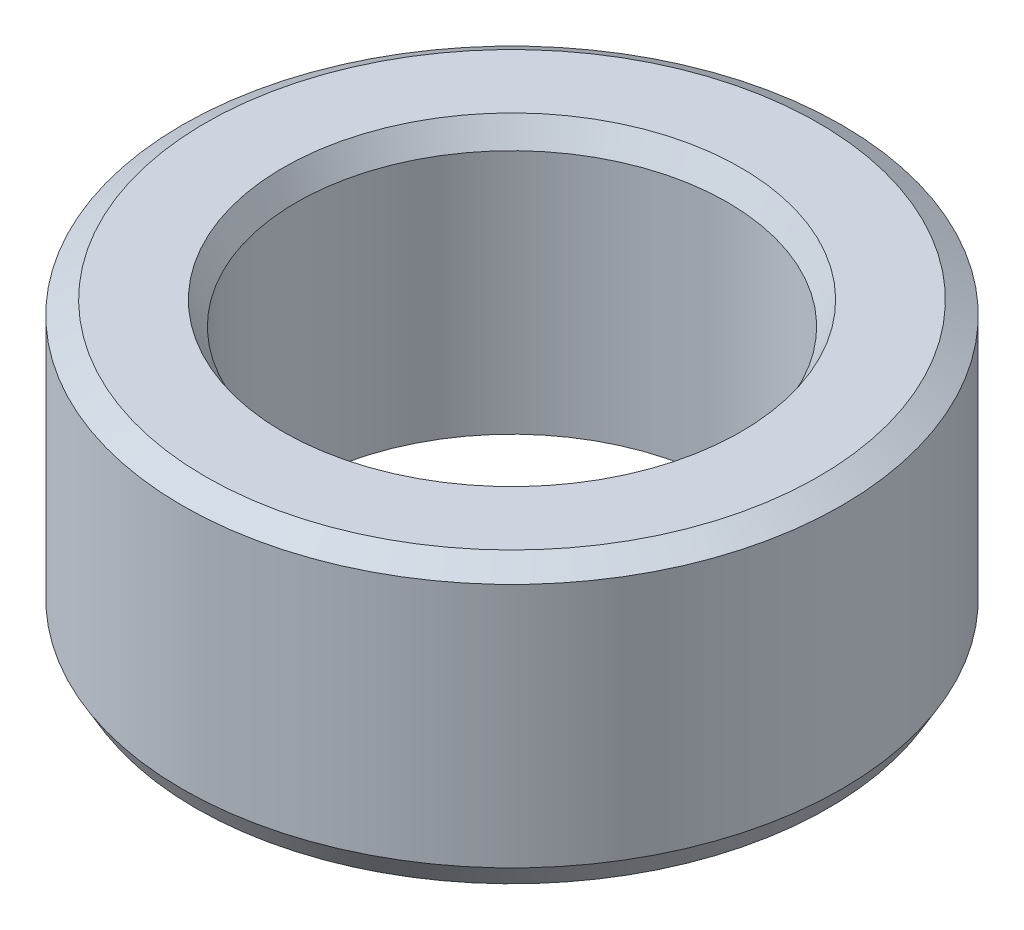
from build123d import *
from OCP.BRepFilletAPI import BRepFilletAPI_MakeChamfer

# Parameters (mm, degrees)
SKETCH1_R           = 50
BOSS_EXTRUDE1_DEPTH = 42.788463699
SKETCH2_R           = 32.672837418
CUT_EXTRUDE1_DEPTH  = 83.648972321
CHAMFER1_SIZE       = 2.033833816
CHAMFER1_SIZE2      = 3.522703503


with BuildPart() as part:
    # Sketch1 → Boss-Extrude1 (new body)
    with BuildSketch(Plane(origin=(0, 0, 0), x_dir=(1, 0, 0), z_dir=(0, 1, 0))):
        Circle(SKETCH1_R)
    extrude(amount=BOSS_EXTRUDE1_DEPTH)

    # Sketch2 → Cut-Extrude1 (cut, through all)
    with BuildSketch(Plane(origin=(0, 0, 0), x_dir=(1, 0, 0), z_dir=(0, 1, 0))):
        Circle(SKETCH2_R)
    extrude(amount=CUT_EXTRUDE1_DEPTH, mode=Mode.SUBTRACT)

    # Chamfer1: one chamfer whose edges measure the first distance from different faces: ONE call of the kernel's chamfer builder (chamfer() names one face for all edges)
    chamfer1_edges_1 = [part.edges().sort_by_distance(p)[0] for p in [
        (-32.672837418, 42.788463699, 0),
    ]]
    chamfer1_side_1 = [part.faces().sort_by_distance(p)[0] for p in [
        (-48.585786438, 42.788463699, 0),
    ]]
    chamfer1_edges_2 = [part.edges().sort_by_distance(p)[0] for p in [
        (-32.672837418, 0, 0),
    ]]
    chamfer1_side_2 = [part.faces().sort_by_distance(p)[0] for p in [
        (-32.672837418, 21.394231849, 0),
    ]]
    chamfer1_edges_3 = [part.edges().sort_by_distance(p)[0] for p in [
        (-50, 0, 0),
    ]]
    chamfer1_side_3 = [part.faces().sort_by_distance(p)[0] for p in [
        (-48.585786438, 0, 0),
    ]]
    chamfer1_edges_4 = [part.edges().sort_by_distance(p)[0] for p in [
        (-50, 42.788463699, 0),
    ]]
    chamfer1_side_4 = [part.faces().sort_by_distance(p)[0] for p in [
        (-50, 21.394231849, 0),
    ]]
    chamfer1 = BRepFilletAPI_MakeChamfer(part.part.solid().wrapped)
    for e in chamfer1_edges_1:
        chamfer1.Add(CHAMFER1_SIZE, CHAMFER1_SIZE2, e.wrapped, chamfer1_side_1[0].wrapped)  # the first distance lies on this face
    for e in chamfer1_edges_2:
        chamfer1.Add(CHAMFER1_SIZE, CHAMFER1_SIZE2, e.wrapped, chamfer1_side_2[0].wrapped)  # the first distance lies on this face
    for e in chamfer1_edges_3:
        chamfer1.Add(CHAMFER1_SIZE, CHAMFER1_SIZE2, e.wrapped, chamfer1_side_3[0].wrapped)  # the first distance lies on this face
    for e in chamfer1_edges_4:
        chamfer1.Add(CHAMFER1_SIZE, CHAMFER1_SIZE2, e.wrapped, chamfer1_side_4[0].wrapped)  # the first distance lies on this face
    add(Compound.cast(chamfer1.Shape()), mode=Mode.REPLACE)


solid = part.part
